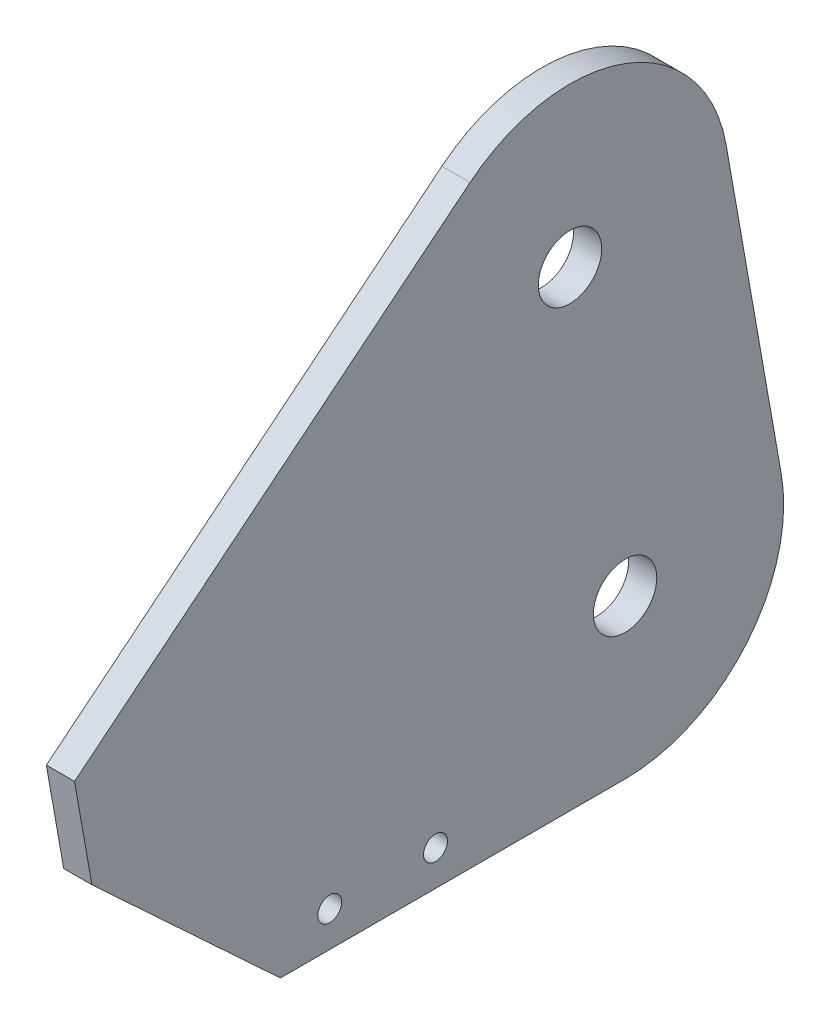
from build123d import *

# Parameters (mm, degrees)
BOSS_EXTRUDE1_DEPTH            = 4
HOLE1_D                        = 9
M3_CLEARANCE_HOLE1_D           = 3.4
M3_CLEARANCE_HOLE1_CSINK_D     = 3.45
M3_CLEARANCE_HOLE1_CSINK_ANGLE = 90


with BuildPart() as part:
    # Sketch2 → Boss-Extrude1 (new body)
    with BuildSketch(Plane.ZY.offset(18)):
        with BuildLine():
            Line((22, 57.257857944), (48.74840947, 82.082529594))
            Line((48.74840947, 82.082529594), (51.205531184, 96.017559299))
            Line((51.205531184, 96.017559299), (-4.905862675, 141.546196581))
            ThreePointArc((-4.905862675, 141.546196581), (-26.951994794, 145.153164468), (-41.240763613, 127.981290827))
            Line((-41.240763613, 127.981290827), (-49.054931608, 83.664941942))
            ThreePointArc((-49.054931608, 83.664941942), (-44.132757136, 65.295136726), (-26.896757165, 57.257857944))
            Line((-26.896757165, 57.257857944), (22, 57.257857944))
        make_face()
    extrude(amount=BOSS_EXTRUDE1_DEPTH)

    # Hole1 (through all)
    with Locations(Plane(origin=(-18, 0, 0), x_dir=(0, 0, -1), z_dir=(1, 0, 0))):
        with Locations((19.08258917, 124.07420683), (26.896757165, 79.757857944)):
            Hole(HOLE1_D / 2)

    # M3 Clearance Hole1 (through all)
    with Locations(Plane.ZY.offset(22)):
        with Locations((15, 62.257857944), (0, 62.257857944)):
            CounterSinkHole(M3_CLEARANCE_HOLE1_D / 2, M3_CLEARANCE_HOLE1_CSINK_D / 2, counter_sink_angle=M3_CLEARANCE_HOLE1_CSINK_ANGLE)


solid = part.part
